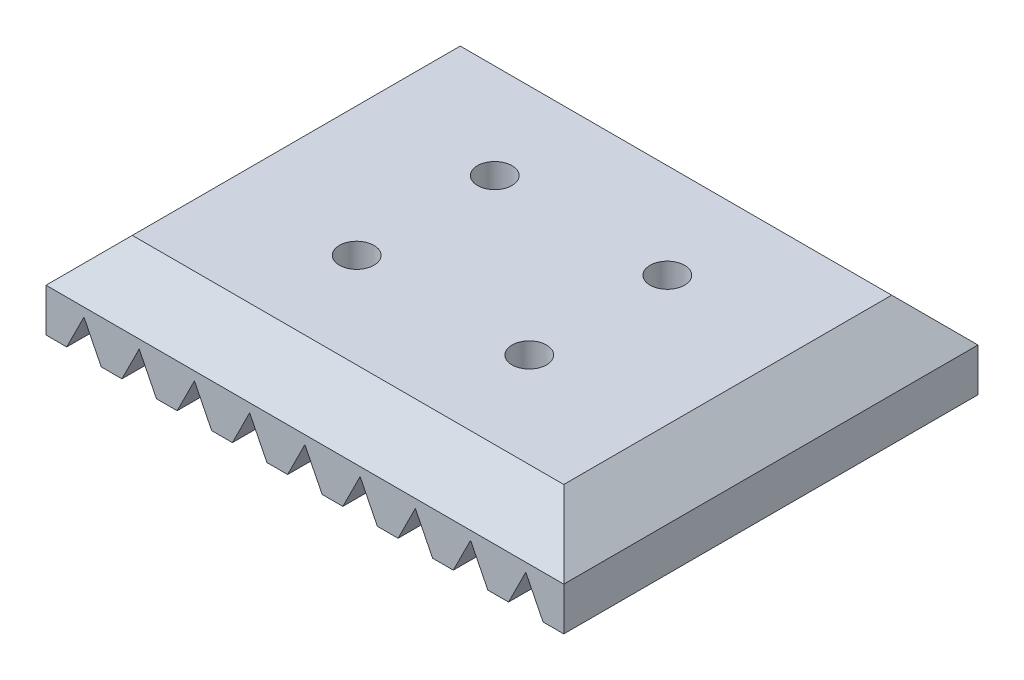
from build123d import *

# Parameters (mm, degrees)
SKETCH1_W           = 76.2
SKETCH1_H           = 60.96
BOSS_EXTRUDE1_DEPTH = 12.7
CHAMFER1_SIZE       = 6.35
CUT_EXTRUDE1_DEPTH  = 99.406562789
CRVPATTERN1_DEPTH   = 60.96
SKETCH3_R           = 2.54
CUT_EXTRUDE2_DEPTH  = 5.08


# Read off the part's stored shape, not the designer's step: CrvPattern1
with BuildPart() as part:
    # Sketch1 → Boss-Extrude1 (new body)
    with BuildSketch(Plane(origin=(0, 0, 0), x_dir=(1, 0, 0), z_dir=(0, 1, 0))):
        with Locations((38.1, -30.48)):
            Rectangle(SKETCH1_W, SKETCH1_H)
    extrude(amount=BOSS_EXTRUDE1_DEPTH)

    # Chamfer1
    chamfer1_edges = [part.edges().sort_by_distance(p)[0] for p in [
        (76.2, 12.7, 30.48),
        (38.1, 12.7, 0),
        (0, 12.7, 30.48),
        (38.1, 12.7, 60.96),
    ]]
    chamfer(chamfer1_edges, length=CHAMFER1_SIZE)

    # Sketch2 → Cut-Extrude1 (cut, through all)
    with BuildSketch(Plane.XY.offset(60.96)):
        Polygon((3.048, 0), (5.588, 5.08), (8.128, 0), align=None)
    extrude(amount=-CUT_EXTRUDE1_DEPTH, mode=Mode.SUBTRACT)

    # CrvPattern1 outline → CrvPattern1 (cut)
    with BuildSketch(Plane.XY):
        Polygon((70.612, 5.08), (68.072, 0), (73.152, 0), align=None)
        Polygon((62.484, 5.08), (59.944, 0), (65.024, 0), align=None)
        Polygon((54.356, 5.08), (51.816, 0), (56.896, 0), align=None)
        Polygon((46.228, 5.08), (43.688, 0), (48.768, 0), align=None)
        Polygon((38.1, 5.08), (35.56, 0), (40.64, 0), align=None)
        Polygon((29.972, 5.08), (27.432, 0), (32.512, 0), align=None)
        Polygon((21.844, 5.08), (19.304, 0), (24.384, 0), align=None)
        Polygon((13.716, 5.08), (11.176, 0), (16.256, 0), align=None)
    extrude(amount=CRVPATTERN1_DEPTH, mode=Mode.SUBTRACT)

    # Sketch3 → Cut-Extrude2 (cut)
    with BuildSketch(Plane(origin=(0, 12.7, 0), x_dir=(1, 0, 0), z_dir=(0, 1, 0))):
        with Locations(Location((25.4, -20.32, 0), (0, 0, 270))):
            Circle(SKETCH3_R)
        with Locations(Location((50.8, -20.32, 0), (0, 0, 270))):
            Circle(SKETCH3_R)
        with Locations(Location((25.4, -40.64, 0), (0, 0, 270))):
            Circle(SKETCH3_R)
        with Locations(Location((50.8, -40.64, 0), (0, 0, 270))):
            Circle(SKETCH3_R)
    extrude(amount=-CUT_EXTRUDE2_DEPTH, mode=Mode.SUBTRACT)


solid = part.part
